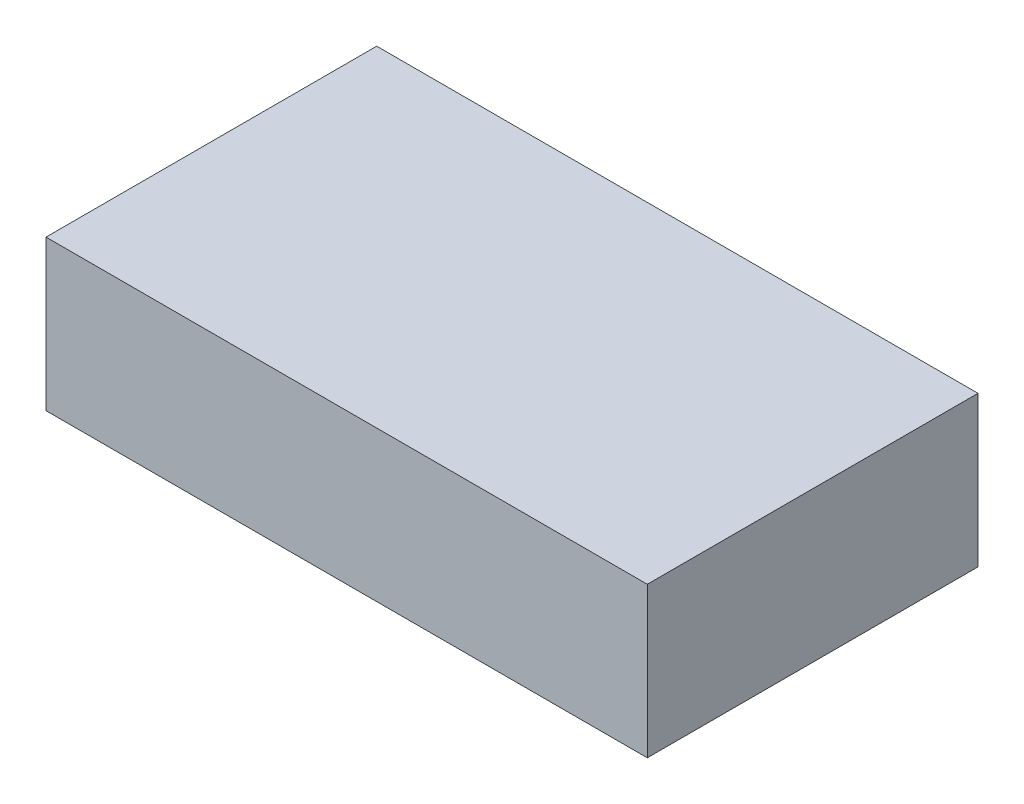
from build123d import *

# Parameters (mm, degrees)
SKETCH1_W           = 200
SKETCH1_H           = 110
BOSS_EXTRUDE1_DEPTH = 50


with BuildPart() as part:
    # Sketch1 → Boss-Extrude1 (new body)
    with BuildSketch(Plane(origin=(0, 0, 0), x_dir=(1, 0, 0), z_dir=(0, 1, 0))):
        with Locations((100, 55)):
            Rectangle(SKETCH1_W, SKETCH1_H)
    extrude(amount=BOSS_EXTRUDE1_DEPTH)


solid = part.part
